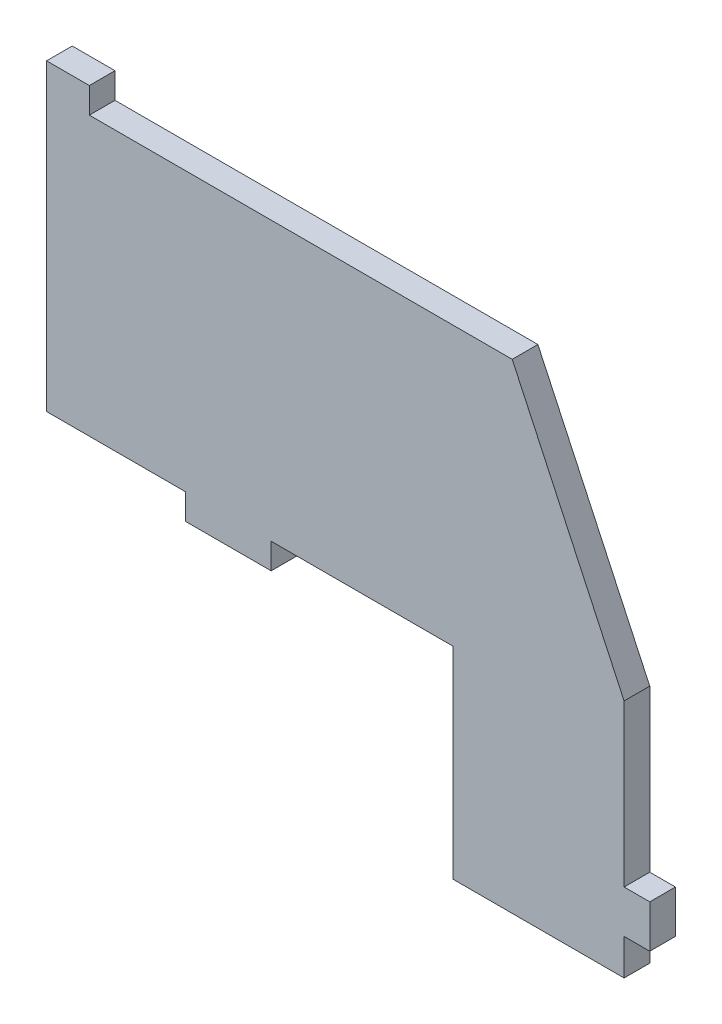
from build123d import *

# Parameters (mm, degrees)
ESQUISSE1_W             = 135
ESQUISSE1_H             = 112.17
BOSS_EXTRU_1_DEPTH      = 6
ESQUISSE2_W             = 95
ESQUISSE2_H             = 47.17
ENL_V_MAT_EXTRU_1_DEPTH = 6
ESQUISSE3_W             = 6
ESQUISSE3_H             = 10
ESQUISSE3_W_2           = 20
ESQUISSE3_H_2           = 6
ESQUISSE3_W_3           = 10
BOSS_EXTRU_2_DEPTH      = 6


with BuildPart() as part:
    # Esquisse1 → Boss.-Extru.1 (new body)
    with BuildSketch(Plane.XY):
        Rectangle(ESQUISSE1_W, ESQUISSE1_H)
    extrude(amount=BOSS_EXTRU_1_DEPTH)

    # Esquisse2 → Enlèv. mat.-Extru.1 (cut)
    with BuildSketch(Plane.XY.offset(6)):
        with Locations((-20, -32.5)):
            Rectangle(ESQUISSE2_W, ESQUISSE2_H)
        Polygon((67.5, 0), (41.347134992, 56.085), (67.5, 56.085), align=None)
    extrude(amount=-ENL_V_MAT_EXTRU_1_DEPTH, mode=Mode.SUBTRACT)

    # Esquisse3 → Boss.-Extru.2 (add)
    with BuildSketch(Plane.XY.offset(6)):
        with Locations((70.5, -42.665)):
            Rectangle(ESQUISSE3_W, ESQUISSE3_H)
        with Locations((-25, -11.915)):
            Rectangle(ESQUISSE3_W_2, ESQUISSE3_H_2)
        with Locations((-62.5, 59.085)):
            Rectangle(ESQUISSE3_W_3, ESQUISSE3_H_2)
    extrude(amount=-BOSS_EXTRU_2_DEPTH)


solid = part.part
